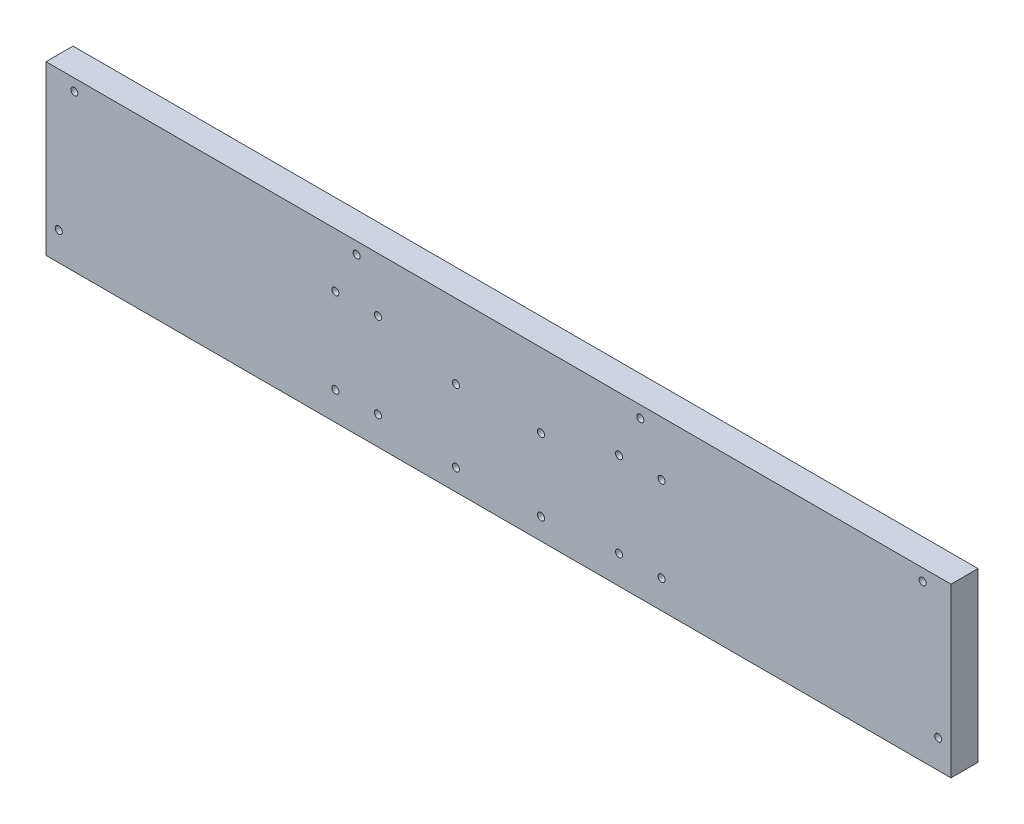
from build123d import *

# Parameters (mm, degrees)
SKETCH1_W                 = 638.1
SKETCH1_H                 = 118.3
BOSS_EXTRUDE1_DEPTH       = 19.05
F_5_0MM_DOWEL_HOLE1_D     = 5
F_5_0MM_DOWEL_HOLE1_DEPTH = 28.497848452
F_5_0MM_DOWEL_HOLE1_TIP   = 1.502151548


with BuildPart() as part:
    # Sketch1 → Boss-Extrude1 (new body)
    with BuildSketch(Plane.XY):
        with Locations((-319.05, 59.15)):
            Rectangle(SKETCH1_W, SKETCH1_H)
    extrude(amount=BOSS_EXTRUDE1_DEPTH)

    # Ø5.0mm Dowel Hole1
    with Locations(Plane(origin=(0, 0, 0), x_dir=(-1, 0, 0), z_dir=(0, 0, -1))):
        with Locations((434.05, 20), (404.05, 20), (404.05, 80), (434.05, 80), (349.05, 15), (349.05, 66), (289.05, 66), (289.05, 15), (234.05, 20), (234.05, 80), (204.05, 80), (204.05, 20), (629.1, 20), (618.1, 110.05), (419.05, 110.05), (219.05, 110.05), (20, 110.05), (9, 20)):
            Hole(F_5_0MM_DOWEL_HOLE1_D / 2, depth=F_5_0MM_DOWEL_HOLE1_DEPTH)
            with Locations((0, 0, -(F_5_0MM_DOWEL_HOLE1_DEPTH + F_5_0MM_DOWEL_HOLE1_TIP / 2))):  # 118° drill point
                Cone(0, F_5_0MM_DOWEL_HOLE1_D / 2, F_5_0MM_DOWEL_HOLE1_TIP, mode=Mode.SUBTRACT)


solid = part.part
